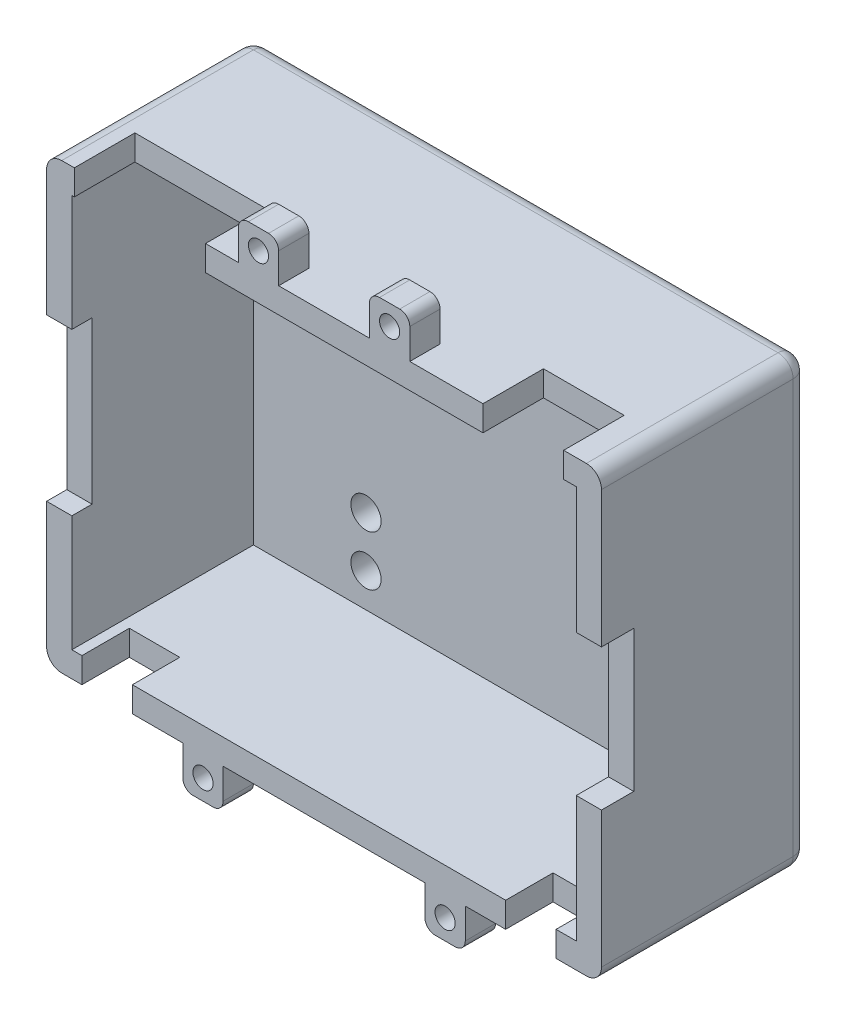
from build123d import *
from build123d.topology import SkipClean

# Parameters (mm, degrees)
SKETCH_1_W           = 50
SKETCH_1_H           = 39
EXTRUDE_1_DEPTH      = 2.5
SKETCH_2_W           = 55
SKETCH_2_H           = 44
SKETCH_2_W_2         = 50
SKETCH_2_H_2         = 39
EXTRUDE_2_DEPTH      = 20.5
FILLET_1_R           = 1.5
SKETCH_3_W           = 4
SKETCH_3_H           = 3
EXTRUDE_2_2_DEPTH    = 4
FILLET_2_R           = 1
SKETCH_4_W           = 4
SKETCH_4_H           = 3
EXTRUDE_3_DEPTH      = 4
FILLET_3_R           = 1
SKETCH_5_W           = 2.5
SKETCH_5_H           = 14
CUT_EXTRUDE_1_DEPTH  = 3.2
SKETCH_6_W           = 13
SKETCH_6_H           = 2.5
CUT_EXTRUDE_2_DEPTH  = 6
SKETCH_7_W           = 8
SKETCH_7_H           = 2.5
CUT_EXTRUDE_3_DEPTH  = 6
SKETCH_8_W           = 2.5
SKETCH_8_H           = 16
CUT_EXTRUDE_4_DEPTH  = 2
FILLET_4_R           = 1.5
CUT_EXTRUDE_5_REACH  = 44.237
SKETCH_9_R           = 1.5
SKETCH_10_W          = 5.5
SKETCH_10_H          = 19.6
EXTRUDE_4_DEPTH      = 2
CUT_EXTRUDE_6_REACH  = 43.425
SKETCH_11_W          = 3.2
SKETCH_11_H          = 6.4
SKETCH_12_W          = 5
SKETCH_12_H          = 2.5
CUT_EXTRUDE_7_DEPTH  = 4.7
CUT_EXTRUDE_8_REACH  = 44.237
SKETCH_14_R          = 1.5
CUT_EXTRUDE_9_REACH  = 44.027
SKETCH_16_R          = 1
SKETCH_17_R          = 1
CUT_EXTRUDE_10_DEPTH = 4
THREAD_1_PITCH       = 0.4
THREAD_2_PITCH       = 0.4


with BuildPart() as part:
    # Sketch 1 → 凸台-拉伸1 (new body)
    with BuildSketch(Plane.XY):
        with Locations((-0.5, 0)):
            Rectangle(SKETCH_1_W, SKETCH_1_H)
    extrude(amount=-EXTRUDE_1_DEPTH)

    # Sketch 2 → Extrude 2 (add)
    with BuildSketch(Plane(origin=(0, 0, -2.5), x_dir=(-1, 0, 0), z_dir=(0, 0, -1))):
        with Locations((0.5, 0)):
            Rectangle(SKETCH_2_W, SKETCH_2_H)
        with Locations((0.5, 0)):
            Rectangle(SKETCH_2_W_2, SKETCH_2_H_2, mode=Mode.SUBTRACT)
    extrude(amount=-EXTRUDE_2_DEPTH)

    # 圆角1
    fillet_1_edges = [part.edges().sort_by_distance(p)[0] for p in [
        (27, -22, 7.75),
        (27, 22, 7.75),
        (-28, 22, 7.75),
        (-28, -22, 7.75),
    ]]
    fillet(fillet_1_edges, radius=FILLET_1_R)

    # 草图3 → Extrude 2 2 (add)
    with BuildSketch(Plane.XZ.offset(22)):
        with Locations((11.5, 16.5)):
            Rectangle(SKETCH_3_W, SKETCH_3_H)
        with Locations((-12.5, 16.5)):
            Rectangle(SKETCH_3_W, SKETCH_3_H)
    extrude(amount=EXTRUDE_2_2_DEPTH)

    # 圆角2
    fillet_2_edges = [part.edges().sort_by_distance(p)[0] for p in [
        (13.5, -26, 16.5),
        (9.5, -26, 16.5),
        (-14.5, -26, 16.5),
        (-10.5, -26, 16.5),
    ]]
    fillet(fillet_2_edges, radius=FILLET_2_R)

    # 草图4 → 凸台-拉伸3 (add)
    with BuildSketch(Plane(origin=(0, 22, 0), x_dir=(1, 0, 0), z_dir=(0, 1, 0))):
        with Locations((-7, -16.5)):
            Rectangle(SKETCH_4_W, SKETCH_4_H)
        with Locations((6, -16.5)):
            Rectangle(SKETCH_4_W, SKETCH_4_H)
    extrude(amount=EXTRUDE_3_DEPTH)

    # 圆角3
    fillet_3_edges = [part.edges().sort_by_distance(p)[0] for p in [
        (-9, 26, 16.5),
        (-5, 26, 16.5),
        (8, 26, 16.5),
        (4, 26, 16.5),
    ]]
    fillet(fillet_3_edges, radius=FILLET_3_R)

    # 草图5 → 切除-拉伸1 (cut)
    with BuildSketch(Plane.XY.offset(18)):
        with Locations((25.75, -0.008831254)):
            Rectangle(SKETCH_5_W, SKETCH_5_H)
    extrude(amount=-CUT_EXTRUDE_1_DEPTH, mode=Mode.SUBTRACT)

    # 草图6 → 切除-拉伸2 (cut)
    with BuildSketch(Plane.XY.offset(18)):
        with Locations((-18.75, 20.75)):
            Rectangle(SKETCH_6_W, SKETCH_6_H)
    extrude(amount=-CUT_EXTRUDE_2_DEPTH, mode=Mode.SUBTRACT)

    # 草图7 → 切除-拉伸3 (cut)
    with BuildSketch(Plane.XY.offset(18)):
        with Locations((19.25, 20.75)):
            Rectangle(SKETCH_7_W, SKETCH_7_H)
    extrude(amount=-CUT_EXTRUDE_3_DEPTH, mode=Mode.SUBTRACT)

    # 草图8 → 切除-拉伸4 (cut)
    with BuildSketch(Plane.XY.offset(18)):
        with Locations((-26.75, 0)):
            Rectangle(SKETCH_8_W, SKETCH_8_H)
    extrude(amount=-CUT_EXTRUDE_4_DEPTH, mode=Mode.SUBTRACT)

    # 圆角4
    fillet_4_edges = [part.edges().sort_by_distance(p)[0] for p in [
        (-28, 0, -2.5),
        (27, 0, -2.5),
        (-0.5, -22, -2.5),
        (-0.5, 22, -2.5),
        (26.560660172, 21.560660172, -2.5),
        (26.560660172, -21.560660172, -2.5),
        (-27.560660172, -21.560660172, -2.5),
        (-27.560660172, 21.560660172, -2.5),
    ]]
    fillet(fillet_4_edges, radius=FILLET_4_R)

    # 草图9 → 切除-拉伸5 (cut, up to next)
    with BuildSketch(Plane.XY, mode=Mode.PRIVATE) as cut_extrude_5_sk1:
        with Locations((-14.343587503, -16.137330573)):
            Circle(SKETCH_9_R)
    cut_extrude_5_tool1 = extrude(cut_extrude_5_sk1.sketch, amount=-CUT_EXTRUDE_5_REACH, mode=Mode.PRIVATE) & part.part
    # 草图9 → 切除-拉伸5 (cut, up to next)
    with BuildSketch(Plane.XY, mode=Mode.PRIVATE) as cut_extrude_5_sk2:
        with Locations((-14.343587503, -11.154611246)):
            Circle(SKETCH_9_R)
    cut_extrude_5_tool2 = extrude(cut_extrude_5_sk2.sketch, amount=-CUT_EXTRUDE_5_REACH, mode=Mode.PRIVATE) & part.part
    add(cut_extrude_5_tool1.solids().sort_by_distance((-14.343588, -16.137331, 0))[0], mode=Mode.SUBTRACT)
    add(cut_extrude_5_tool2.solids().sort_by_distance((-14.343588, -11.154611, 0))[0], mode=Mode.SUBTRACT)

    # 草图10 → 凸台-拉伸4 (add)
    with BuildSketch(Plane.XY):
        with Locations((19.615365227, 2.154102198)):
            Rectangle(SKETCH_10_W, SKETCH_10_H)
    extrude(amount=EXTRUDE_4_DEPTH)

    # 草图11 → 切除-拉伸6 (cut, up to next)
    with BuildSketch(Plane.XY.offset(2), mode=Mode.PRIVATE) as cut_extrude_6_sk1:
        with Locations((19.615365227, 2.154102198)):
            Rectangle(SKETCH_11_W, SKETCH_11_H)
    cut_extrude_6_tool1 = extrude(cut_extrude_6_sk1.sketch, amount=-CUT_EXTRUDE_6_REACH, mode=Mode.PRIVATE) & part.part
    add(cut_extrude_6_tool1.solids().sort_by_distance((19.615365, 2.154102, 2))[0], mode=Mode.SUBTRACT)

    # 草图12 → 切除-拉伸7 (cut)
    with BuildSketch(Plane.XY.offset(18)):
        with Locations((20, -20.75)):
            Rectangle(SKETCH_12_W, SKETCH_12_H)
        with Locations((-22, -20.75)):
            Rectangle(SKETCH_12_W, SKETCH_12_H)
    extrude(amount=-CUT_EXTRUDE_7_DEPTH, mode=Mode.SUBTRACT)

    # 草图14 → 切除-拉伸8 (cut, up to next)
    with BuildSketch(Plane.XY, mode=Mode.PRIVATE) as cut_extrude_8_sk1:
        with Locations((19.615365227, -10.757034559)):
            Circle(SKETCH_14_R)
    cut_extrude_8_tool1 = extrude(cut_extrude_8_sk1.sketch, amount=-CUT_EXTRUDE_8_REACH, mode=Mode.PRIVATE) & part.part
    add(cut_extrude_8_tool1.solids().sort_by_distance((19.615365, -10.757035, 0))[0], mode=Mode.SUBTRACT)

    # 草图16 → 切除-拉伸9 (cut, up to next)
    with BuildSketch(Plane(origin=(0, 0, 15), x_dir=(-1, 0, 0), z_dir=(0, 0, -1)), mode=Mode.PRIVATE) as cut_extrude_9_sk1:
        with Locations((-6, 24)):
            Circle(SKETCH_16_R)
    cut_extrude_9_tool1 = extrude(cut_extrude_9_sk1.sketch, amount=-CUT_EXTRUDE_9_REACH, mode=Mode.PRIVATE) & part.part
    # 草图16 → 切除-拉伸9 (cut, up to next)
    with BuildSketch(Plane(origin=(0, 0, 15), x_dir=(-1, 0, 0), z_dir=(0, 0, -1)), mode=Mode.PRIVATE) as cut_extrude_9_sk2:
        with Locations((7, 24)):
            Circle(SKETCH_16_R)
    cut_extrude_9_tool2 = extrude(cut_extrude_9_sk2.sketch, amount=-CUT_EXTRUDE_9_REACH, mode=Mode.PRIVATE) & part.part
    # 草图16 → 切除-拉伸9 (cut, up to next)
    with BuildSketch(Plane(origin=(0, 0, 15), x_dir=(-1, 0, 0), z_dir=(0, 0, -1)), mode=Mode.PRIVATE) as cut_extrude_9_sk3:
        with Locations((-11.5, -24)):
            Circle(SKETCH_16_R)
    cut_extrude_9_tool3 = extrude(cut_extrude_9_sk3.sketch, amount=-CUT_EXTRUDE_9_REACH, mode=Mode.PRIVATE) & part.part
    # 草图16 → 切除-拉伸9 (cut, up to next)
    with BuildSketch(Plane(origin=(0, 0, 15), x_dir=(-1, 0, 0), z_dir=(0, 0, -1)), mode=Mode.PRIVATE) as cut_extrude_9_sk4:
        with Locations((12.5, -24)):
            Circle(SKETCH_16_R)
    cut_extrude_9_tool4 = extrude(cut_extrude_9_sk4.sketch, amount=-CUT_EXTRUDE_9_REACH, mode=Mode.PRIVATE) & part.part
    add(cut_extrude_9_tool1.solids().sort_by_distance((6, 24, 15))[0], mode=Mode.SUBTRACT)
    add(cut_extrude_9_tool2.solids().sort_by_distance((-7, 24, 15))[0], mode=Mode.SUBTRACT)
    add(cut_extrude_9_tool3.solids().sort_by_distance((11.5, -24, 15))[0], mode=Mode.SUBTRACT)
    add(cut_extrude_9_tool4.solids().sort_by_distance((-12.5, -24, 15))[0], mode=Mode.SUBTRACT)

    # 草图17 → 切除-拉伸10 (cut)
    with BuildSketch(Plane.XY.offset(2)):
        with Locations((19.615365227, 9.654102198)):
            Circle(SKETCH_17_R)
        with Locations((19.615365227, -5.345897802)):
            Circle(SKETCH_17_R)
    extrude(amount=-CUT_EXTRUDE_10_DEPTH, mode=Mode.SUBTRACT)

    # 螺纹线1: the profile of Sketch 1 2 profile screwed along a right-hand helix of 10 turns, 6 arcs to a turn; built about Z, then put on its axis
    with SkipClean():  # the faces are left unmerged after this step: merging them gives an invalid solid
        thread_1_z = Axis((0, 0, 0), (0, 0, 1))
        thread_1_corners = [(0.9997, 0, -0.000173205), (1.21650635, 0, 0.124999999), (1.21650635, 0, 0.174999999), (0.9997, 0, 0.300173204)]
        with BuildLine(mode=Mode.PRIVATE) as thread_1_profile:
            Line(thread_1_corners[0], thread_1_corners[1])
            Line(thread_1_corners[1], thread_1_corners[2])
            Line(thread_1_corners[2], thread_1_corners[3])
            Line(thread_1_corners[3], thread_1_corners[0])
        thread_1_cap = Face(thread_1_profile.wire())
        thread_1_turn_angles = [0, 30, 60, 90, 120, 150, 180, 210, 240, 270, 300, 330, 360]
        thread_1_turn_weights = [1, 0.8660254037844387, 1, 0.8660254037844387, 1, 0.8660254037844387, 1, 0.8660254037844387, 1, 0.8660254037844387, 1, 0.8660254037844387, 1]
        thread_1_turn_rails = [Edge.make_bspline([Vector(p[0], p[1], 0).rotate(thread_1_z, thread_1_turn_angles[k]) / thread_1_turn_weights[k] + Vector(0, 0, p[2] + THREAD_1_PITCH * thread_1_turn_angles[k] / 360) for k in range(13)], [0, 0, 0, 1, 1, 2, 2, 3, 3, 4, 4, 5, 5, 6, 6, 6], 2, thread_1_turn_weights) for p in thread_1_corners]
        thread_1_turn_sides = [Face.make_surface_from_curves(thread_1_turn_rails[p[0]], thread_1_turn_rails[p[1]]) for p in [(0, 1), (1, 2), (2, 3), (3, 0)]]
        thread_1 = Plane(origin=(19.615365227, 9.654102198, 2), x_dir=(-1, 0, 0), z_dir=(0, 0, -1)) * Solid(Shell([*[p.moved(Location((0, 0, THREAD_1_PITCH * i))) for i in range(10) for p in thread_1_turn_sides], thread_1_cap, thread_1_cap.rotate(thread_1_z, 3600).moved(Location((0, 0, THREAD_1_PITCH * 3600 / 360)))]))
        add(thread_1, mode=Mode.SUBTRACT)

    # 螺纹线2: the profile of Sketch 2 2 profile screwed along a right-hand helix of 10 turns, 6 arcs to a turn; built about Z, then put on its axis
    with SkipClean():  # the faces are left unmerged after this step: merging them gives an invalid solid
        thread_2_z = Axis((0, 0, 0), (0, 0, 1))
        thread_2_corners = [(0.9997, 0, -0.000173205), (1.21650635, 0, 0.124999999), (1.21650635, 0, 0.174999999), (0.9997, 0, 0.300173204)]
        with BuildLine(mode=Mode.PRIVATE) as thread_2_profile:
            Line(thread_2_corners[0], thread_2_corners[1])
            Line(thread_2_corners[1], thread_2_corners[2])
            Line(thread_2_corners[2], thread_2_corners[3])
            Line(thread_2_corners[3], thread_2_corners[0])
        thread_2_cap = Face(thread_2_profile.wire())
        thread_2_turn_angles = [0, 30, 60, 90, 120, 150, 180, 210, 240, 270, 300, 330, 360]
        thread_2_turn_weights = [1, 0.8660254037844387, 1, 0.8660254037844387, 1, 0.8660254037844387, 1, 0.8660254037844387, 1, 0.8660254037844387, 1, 0.8660254037844387, 1]
        thread_2_turn_rails = [Edge.make_bspline([Vector(p[0], p[1], 0).rotate(thread_2_z, thread_2_turn_angles[k]) / thread_2_turn_weights[k] + Vector(0, 0, p[2] + THREAD_2_PITCH * thread_2_turn_angles[k] / 360) for k in range(13)], [0, 0, 0, 1, 1, 2, 2, 3, 3, 4, 4, 5, 5, 6, 6, 6], 2, thread_2_turn_weights) for p in thread_2_corners]
        thread_2_turn_sides = [Face.make_surface_from_curves(thread_2_turn_rails[p[0]], thread_2_turn_rails[p[1]]) for p in [(0, 1), (1, 2), (2, 3), (3, 0)]]
        thread_2 = Plane(origin=(19.615365227, -5.345897802, 2), x_dir=(-1, 0, 0), z_dir=(0, 0, -1)) * Solid(Shell([*[p.moved(Location((0, 0, THREAD_2_PITCH * i))) for i in range(10) for p in thread_2_turn_sides], thread_2_cap, thread_2_cap.rotate(thread_2_z, 3600).moved(Location((0, 0, THREAD_2_PITCH * 3600 / 360)))]))
        add(thread_2, mode=Mode.SUBTRACT)


solid = part.part
